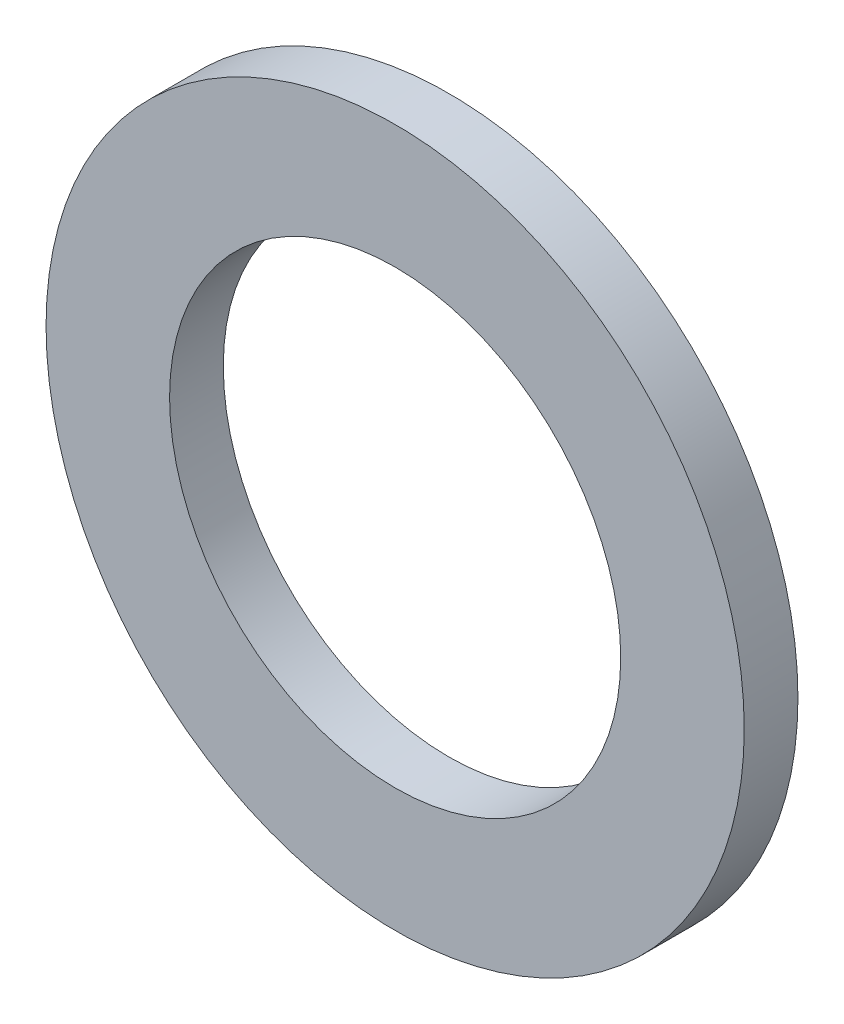
from build123d import *

# Parameters (mm, degrees)
SKETCH1_R           = 6.5
SKETCH1_R_2         = 4.2
BOSS_EXTRUDE1_DEPTH = 1


with BuildPart() as part:
    # Sketch1 → Boss-Extrude1 (new body)
    with BuildSketch(Plane.XY):
        Circle(SKETCH1_R)
        Circle(SKETCH1_R_2, mode=Mode.SUBTRACT)
    extrude(amount=BOSS_EXTRUDE1_DEPTH)


solid = part.part
